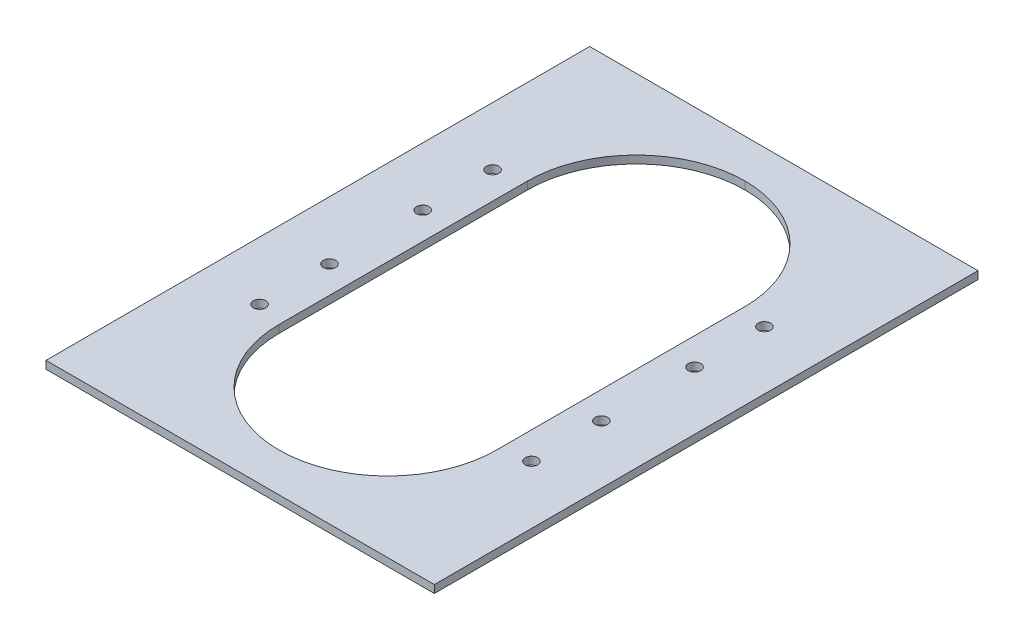
from build123d import *

# Parameters (mm, degrees)
SKETCH_1_W      = 100
SKETCH_1_H      = 140
SKETCH_1_R      = 1.6
SKETCH_1_W_2    = 56
SKETCH_1_H_2    = 120
EXTRUDE_1_DEPTH = 2
FILLET_1_R      = 28


with BuildPart() as part:
    # 草圖1 → 填料-伸長1 (new body)
    with BuildSketch(Plane(origin=(0, 0, 0), x_dir=(1, 0, 0), z_dir=(0, 1, 0))):
        Rectangle(SKETCH_1_W, SKETCH_1_H)
        with Locations(Location((-35, 30, 0), (0, 0, 270))):
            Circle(SKETCH_1_R, mode=Mode.SUBTRACT)
        with Locations(Location((35, 30, 0), (0, 0, 90))):
            Circle(SKETCH_1_R, mode=Mode.SUBTRACT)
        with Locations(Location((-35, 12, 0), (0, 0, 270))):
            Circle(SKETCH_1_R, mode=Mode.SUBTRACT)
        with Locations(Location((35, 12, 0), (0, 0, 90))):
            Circle(SKETCH_1_R, mode=Mode.SUBTRACT)
        with Locations(Location((35, -12, 0), (0, 0, 270))):
            Circle(SKETCH_1_R, mode=Mode.SUBTRACT)
        with Locations(Location((35, -30, 0), (0, 0, 270))):
            Circle(SKETCH_1_R, mode=Mode.SUBTRACT)
        with Locations(Location((-35, -30, 0), (0, 0, 90))):
            Circle(SKETCH_1_R, mode=Mode.SUBTRACT)
        with Locations(Location((-35, -12, 0), (0, 0, 90))):
            Circle(SKETCH_1_R, mode=Mode.SUBTRACT)
        Rectangle(SKETCH_1_W_2, SKETCH_1_H_2, mode=Mode.SUBTRACT)
    extrude(amount=EXTRUDE_1_DEPTH)

    # 圓角1
    fillet_1_edges = [part.edges().sort_by_distance(p)[0] for p in [
        (28, 1, -60),
        (-28, 1, -60),
        (-28, 1, 60),
        (28, 1, 60),
    ]]
    fillet(fillet_1_edges, radius=FILLET_1_R - 0.0001)  # a hair under: the kernel refuses the full size


solid = part.part
